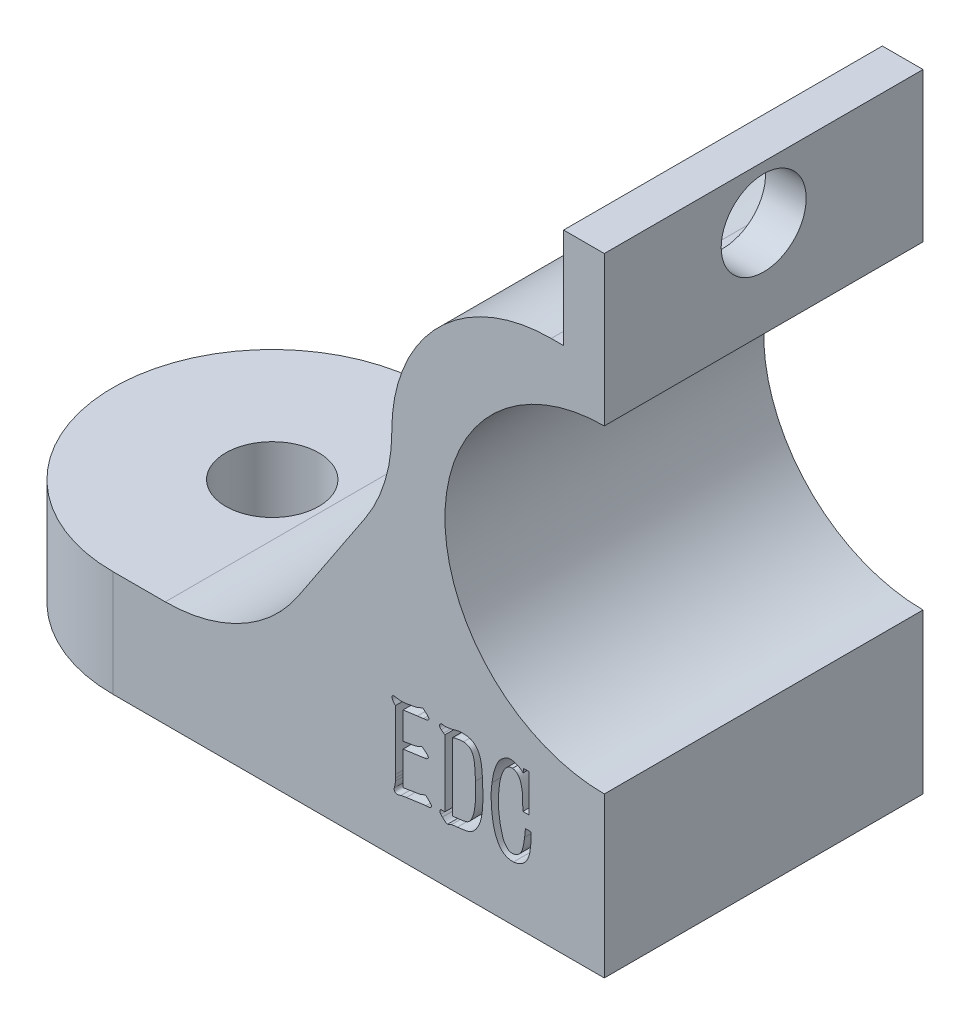
from build123d import *

# Parameters (mm, degrees)
SKETCH_1_R          = 1.75
EXTRUDE_1_DEPTH     = 4
EXTRUDE_2_DEPTH     = 12
SKETCH_3_R          = 1.6
CUT_EXTRUDE_1_DEPTH = 36.659822987
SKETCH_4_W          = 33.766554859
SKETCH_4_H          = 17.559956571
CUT_EXTRUDE_2_DEPTH = 35.359057397
FILLET_2_R          = 6
CUT_EXTRUDE_START   = -12
CUT_EXTRUDE_3_DEPTH = 12


# Read off the part's stored shape, not the designer's step: 切除-拉伸3
with BuildPart() as part:
    # 草图1 → 凸台-拉伸1 (new body)
    with BuildSketch(Plane(origin=(0, 0, 0), x_dir=(1, 0, 0), z_dir=(0, 1, 0))):
        with BuildLine():
            Line((-21.560120485, 6), (15.439879515, 6))
            ThreePointArc((15.439879515, 6), (21.439879515, 0), (15.439879515, -6))
            Line((15.439879515, -6), (-21.560120485, -6))
            ThreePointArc((-21.560120485, -6), (-27.560120485, 0), (-21.560120485, 6))
        make_face()
        with Locations(Location((-21.560120485, 0, 0), (0, 0, 270))):
            Circle(SKETCH_1_R, mode=Mode.SUBTRACT)
        with Locations(Location((15.439879515, 0, 0), (0, 0, 270))):
            Circle(SKETCH_1_R, mode=Mode.SUBTRACT)
    extrude(amount=EXTRUDE_1_DEPTH)

    # 草图2 → 凸台-拉伸2 (add, through all)
    with BuildSketch(Plane.XY.offset(6)):
        with BuildLine():
            Line((-11.060120485, 12), (-16.368422632, 4))
            Line((-16.368422632, 4), (-3.060120485, 4))
            Line((-3.060120485, 4), (-3.060120485, 6))
            ThreePointArc((-3.060120485, 6), (-9.060120485, 12), (-3.060120485, 18))
            Line((-3.060120485, 18), (-3.060120485, 23.621024031))
            Line((-3.060120485, 23.621024031), (-4.592219886, 23.621024031))
            Line((-4.592219886, 23.621024031), (-4.592219886, 19.851921512))
            Line((-4.592219886, 19.851921512), (-11.060120485, 19.851921512))
            Line((-11.060120485, 19.851921512), (-11.060120485, 12))
        make_face()
    extrude(amount=-EXTRUDE_2_DEPTH)

    # 草图3 → 切除-拉伸1 (cut, through all)
    with BuildSketch(Plane.ZY.offset(4.592219886)):
        with Locations((0, 21.621024031)):
            Circle(SKETCH_3_R)
    extrude(amount=-CUT_EXTRUDE_1_DEPTH, mode=Mode.SUBTRACT)

    # 草图4 → 切除-拉伸2 (cut, through all)
    with BuildSketch(Plane(origin=(0, 4, 0), x_dir=(1, 0, 0), z_dir=(0, 1, 0))):
        with Locations((13.823156945, -2.779978286)):
            Rectangle(SKETCH_4_W, SKETCH_4_H)
    extrude(amount=-CUT_EXTRUDE_2_DEPTH, mode=Mode.SUBTRACT)

    # 圆角2
    fillet_2_edges = [part.edges().sort_by_distance(p)[0] for p in [
        (-16.368422632, 4, 0),
        (-11.060120485, 12, 0),
        (-11.060120485, 19.851921512, 0),
    ]]
    fillet(fillet_2_edges, radius=FILLET_2_R)

    # 切除-拉伸3 outline → 切除-拉伸3 (cut)
    # profile 1 of 3: a face of its own
    with BuildSketch(Plane.XY.offset(6).offset(CUT_EXTRUDE_START)):
        with BuildLine():
            add(Edge.make_bspline(
                [(-6.543364146, 5.366767449), (-6.508335438, 5.361029912), (-6.438267686, 5.349553145), (-6.337194207, 5.314781698), (-6.242324982, 5.265146648), (-6.173248536, 5.210008143), (-6.133227112, 5.171818503), (-6.119581927, 5.157647179), (-6.117647589, 5.155617503)],
                knots=[0, 0, 0, 0, 0.181146539, 0.362346535, 0.543653396, 0.725617877, 0.811880467, 0.826217423, 0.826217423, 0.826217423, 0.826217423], degree=3))
            add(Edge.make_bspline(
                [(-7.289901542, 4.253300584), (-7.279879783, 4.328127804), (-7.259959472, 4.47686233), (-7.214534484, 4.657430919), (-7.170707329, 4.793132625), (-7.13789594, 4.884767369), (-7.101620716, 4.964571664), (-7.065437295, 5.035297703), (-7.024788163, 5.096764323), (-6.981937321, 5.151909633), (-6.935353145, 5.201055877), (-6.885627831, 5.242828497), (-6.836473889, 5.278356839), (-6.791315433, 5.308651764), (-6.750081717, 5.331283214), (-6.699732178, 5.35324973), (-6.630831866, 5.369486356), (-6.574035181, 5.367720849), (-6.543364146, 5.366767449)],
                knots=[0, 0, 0, 0, 0.154226345, 0.306556652, 0.379675384, 0.445752334, 0.50534458, 0.558760679, 0.607948867, 0.655725679, 0.701371485, 0.746071266, 0.78825069, 0.825317709, 0.857153149, 0.884242778, 0.937489417, 1, 1, 1, 1], degree=3))
            add(Edge.make_bspline(
                [(-6.47549711, 2.075589099), (-6.510638084, 2.0744179), (-6.581360904, 2.07206081), (-6.685505523, 2.09433433), (-6.782154953, 2.132259327), (-6.856567653, 2.174514822), (-6.908426717, 2.218265261), (-6.947052596, 2.255532905), (-6.983035534, 2.299823044), (-7.018549863, 2.349558105), (-7.052366262, 2.4052991), (-7.085614403, 2.466859111), (-7.116406, 2.534943981), (-7.1583976, 2.635153656), (-7.203041263, 2.773482172), (-7.238291564, 2.920747525), (-7.26172435, 3.047043321), (-7.276252896, 3.149144865), (-7.289790681, 3.256019226), (-7.30470151, 3.404818921), (-7.315481213, 3.591371373), (-7.32186884, 3.813515919), (-7.315337186, 4.033881744), (-7.298421574, 4.179803114), (-7.289901542, 4.253300584)],
                knots=[0, 0, 0, 0, 0.040560554, 0.081629972, 0.122067936, 0.160498857, 0.179908728, 0.200453509, 0.222515076, 0.245822335, 0.271131183, 0.297900222, 0.326730499, 0.357554046, 0.423594813, 0.494619703, 0.532646947, 0.572188961, 0.613933823, 0.657297468, 0.745202701, 0.830085187, 0.914417547, 1, 1, 1, 1], degree=3))
            add(Edge.make_bspline(
                [(-5.812488374, 3.380724407), (-5.812714105, 3.350146694), (-5.813123361, 3.29470863), (-5.813974432, 3.220379408), (-5.814373284, 3.163438332), (-5.815900718, 3.119915621), (-5.818656312, 3.081409673), (-5.821474042, 3.039364442), (-5.825959779, 2.98988409), (-5.834021703, 2.917381338), (-5.841837209, 2.831437177), (-5.85333973, 2.735231105), (-5.870127323, 2.640796436), (-5.901688637, 2.540477566), (-5.944932272, 2.432598259), (-5.994837567, 2.344473734), (-6.045525973, 2.278682702), (-6.090314465, 2.231755025), (-6.143965019, 2.190453225), (-6.202967252, 2.152772154), (-6.266513355, 2.120248581), (-6.334283403, 2.09769249), (-6.403921624, 2.081168558), (-6.451541161, 2.077456515), (-6.47549711, 2.075589099)],
                knots=[0, 0, 0, 0, 0.056090983, 0.101694181, 0.136353878, 0.160539566, 0.181560551, 0.207162126, 0.237837007, 0.272685179, 0.340973981, 0.396120934, 0.450409014, 0.516624624, 0.588604774, 0.663379156, 0.701414258, 0.7407581, 0.781993536, 0.825256768, 0.869102472, 0.91250966, 0.955986255, 1, 1, 1, 1], degree=3))
            Line((-5.812488374, 3.380724407), (-6.02951373, 3.391165489))
            Line((-6.02951373, 3.391165489), (-6.060091186, 3.086136723))
            add(Edge.make_bspline(
                [(-6.547838896, 2.333632994), (-6.525631806, 2.333500762), (-6.480676738, 2.333233079), (-6.41368105, 2.349280539), (-6.348627928, 2.376474627), (-6.287998154, 2.417915808), (-6.23274537, 2.472033589), (-6.186566119, 2.541580229), (-6.148204944, 2.624455891), (-6.121599707, 2.721287043), (-6.099857323, 2.827879189), (-6.08543861, 2.920245829), (-6.075067529, 2.990474555), (-6.067934851, 3.032384567), (-6.063698995, 3.063036369), (-6.061100311, 3.079675423), (-6.060091186, 3.086136723)],
                knots=[0, 0, 0, 0, 0.066450197, 0.134518894, 0.205066106, 0.277089639, 0.353600486, 0.435768077, 0.52624402, 0.62659438, 0.736355408, 0.852775754, 0.907126108, 0.949449962, 0.980370342, 1, 1, 1, 1], degree=3))
            add(Edge.make_bspline(
                [(-7.034840813, 3.485135231), (-7.031121319, 3.440612533), (-7.023461275, 3.348921081), (-7.009494057, 3.232282107), (-6.993789854, 3.132662507), (-6.978044182, 3.050108471), (-6.958562586, 2.960605656), (-6.936218581, 2.867851149), (-6.912964165, 2.778889167), (-6.889230729, 2.701543934), (-6.867252063, 2.638780885), (-6.838958222, 2.575783364), (-6.799397723, 2.511352804), (-6.74988934, 2.444872364), (-6.699315548, 2.392824506), (-6.650688847, 2.355592585), (-6.599607383, 2.337009706), (-6.565376207, 2.334776903), (-6.547838896, 2.333632994)],
                knots=[0, 0, 0, 0, 0.100728522, 0.2074435, 0.264759375, 0.328077893, 0.396897856, 0.471260082, 0.543180506, 0.604168904, 0.653635522, 0.693017991, 0.759632004, 0.823641362, 0.879525224, 0.922919229, 0.960509989, 1, 1, 1, 1], degree=3))
            add(Edge.make_bspline(
                [(-6.515769857, 5.109469346), (-6.531207113, 5.110064963), (-6.562368114, 5.111267251), (-6.60981353, 5.101923567), (-6.656384267, 5.081336378), (-6.703747357, 5.053200589), (-6.749889801, 5.013617243), (-6.792714078, 4.96180999), (-6.835074768, 4.899582634), (-6.872322903, 4.825615898), (-6.907053744, 4.744352388), (-6.93752408, 4.657611902), (-6.963789558, 4.566797209), (-6.990316619, 4.442675194), (-7.015010017, 4.291304331), (-7.033316669, 4.116916153), (-7.040375386, 3.952064041), (-7.04496665, 3.793667241), (-7.042408831, 3.638439526), (-7.037356032, 3.536085674), (-7.034840813, 3.485135231)],
                knots=[0, 0, 0, 0, 0.025029465, 0.050523433, 0.077664636, 0.10736617, 0.13972527, 0.175806298, 0.216226833, 0.261728794, 0.310019606, 0.359687961, 0.410926196, 0.463427513, 0.565701011, 0.659859465, 0.747978257, 0.833586678, 0.917161569, 1, 1, 1, 1], degree=3))
            add(Edge.make_bspline(
                [(-6.124229264, 3.899049572), (-6.124398406, 3.93484835), (-6.124708514, 4.000482867), (-6.126320967, 4.095698351), (-6.128800879, 4.189664943), (-6.131727104, 4.290849668), (-6.135061085, 4.39890092), (-6.144879545, 4.509239906), (-6.161382762, 4.620642606), (-6.185173265, 4.73203228), (-6.216348672, 4.838043913), (-6.253477113, 4.916757813), (-6.287210003, 4.970558271), (-6.313997185, 5.004726117), (-6.342430601, 5.03474392), (-6.384050182, 5.065720485), (-6.440863605, 5.096196362), (-6.490754969, 5.105036843), (-6.515769857, 5.109469346)],
                knots=[0, 0, 0, 0, 0.078227482, 0.143424532, 0.208089835, 0.283630523, 0.364637885, 0.444263732, 0.525545668, 0.610571659, 0.69304657, 0.766429327, 0.799885619, 0.831617141, 0.86119718, 0.889880721, 0.94478761, 1, 1, 1, 1], degree=3))
            Line((-6.124229264, 3.899049572), (-5.887067534, 3.899049572))
            Line((-5.887067534, 3.899049572), (-5.887067534, 5.313816245))
            Line((-5.887067534, 5.313816245), (-6.09887235, 5.313816245))
            Line((-6.09887235, 5.313816245), (-6.117647589, 5.155617503))
        make_face()
    # profile 2 of 3: a face of its own
    with BuildSketch(Plane.XY.offset(6).offset(CUT_EXTRUDE_START)):
        with BuildLine():
            add(Edge.make_bspline(
                [(-9.062648186, 4.927496194), (-9.070181792, 4.931599383), (-9.086380554, 4.940422061), (-9.101529485, 4.950950253), (-9.109633057, 4.956582067)],
                knots=[0, 0, 0, 0, 0.465072976, 1, 1, 1, 1], degree=3))
            Line((-9.062648186, 4.927496194), (-9.062648186, 2.417907445))
            Line((-9.062648186, 2.417907445), (-9.155126345, 2.417907445))
            add(Edge.make_bspline(
                [(-9.21329809, 2.262782791), (-9.220305342, 2.270781611), (-9.233062245, 2.285343692), (-9.246528071, 2.308100008), (-9.255563248, 2.328440674), (-9.254809399, 2.352793819), (-9.246066491, 2.377752745), (-9.229746288, 2.405103635), (-9.195857225, 2.420540119), (-9.170168984, 2.418879738), (-9.155126345, 2.417907445)],
                knots=[0, 0, 0, 0, 0.135453669, 0.246597291, 0.338065694, 0.414309589, 0.55095017, 0.674315892, 0.809284397, 1, 1, 1, 1], degree=3))
            Line((-9.21329809, 2.262782791), (-9.155872137, 2.200882088))
            add(Edge.make_bspline(
                [(-8.958237361, 2.066639599), (-8.966027112, 2.06637974), (-8.98342977, 2.065799202), (-9.010344636, 2.077514675), (-9.040530387, 2.09466526), (-9.071117301, 2.119470224), (-9.100173469, 2.14491751), (-9.124190808, 2.168156931), (-9.143251036, 2.18498614), (-9.152244402, 2.196313051), (-9.155872137, 2.200882088)],
                knots=[0, 0, 0, 0, 0.09428508, 0.210637185, 0.350900231, 0.519934663, 0.690086105, 0.823425343, 0.928773499, 1, 1, 1, 1], degree=3))
            add(Edge.make_bspline(
                [(-8.806095874, 2.130031886), (-8.818176847, 2.126943896), (-8.84689977, 2.119602095), (-8.887207012, 2.098077117), (-8.924299441, 2.076511065), (-8.948924382, 2.06934845), (-8.958237361, 2.066639599)],
                knots=[0, 0, 0, 0, 0.225502421, 0.536139678, 0.824571291, 1, 1, 1, 1], degree=3))
            Line((-8.806095874, 2.130031886), (-8.589070517, 2.154643009))
            add(Edge.make_bspline(
                [(-7.625507764, 3.559714392), (-7.626801335, 3.537592002), (-7.629533386, 3.490868987), (-7.632791719, 3.416732939), (-7.638462134, 3.334982842), (-7.645731143, 3.216689228), (-7.660237463, 3.066571856), (-7.686249917, 2.918894633), (-7.714055901, 2.804980767), (-7.739668574, 2.722922716), (-7.772623846, 2.644469354), (-7.808029535, 2.568862757), (-7.849310183, 2.49931305), (-7.892348964, 2.435342982), (-7.938556651, 2.378705455), (-7.987223181, 2.328660223), (-8.03958218, 2.286421933), (-8.096204337, 2.252668972), (-8.156511479, 2.226069119), (-8.222680852, 2.207510299), (-8.297235137, 2.193800312), (-8.382856521, 2.180627162), (-8.481562763, 2.167165832), (-8.551764982, 2.158988469), (-8.589070517, 2.154643009)],
                knots=[0, 0, 0, 0, 0.034032554, 0.071877565, 0.113958999, 0.159875043, 0.25389838, 0.345415653, 0.389862195, 0.433933293, 0.477252152, 0.520454768, 0.562034426, 0.601321324, 0.638767527, 0.674133794, 0.708358539, 0.741751196, 0.775089245, 0.809282033, 0.847019048, 0.891459031, 0.94232121, 1, 1, 1, 1], degree=3))
            add(Edge.make_bspline(
                [(-8.408588949, 5.317545203), (-8.384970324, 5.317231097), (-8.339179466, 5.316622119), (-8.272820335, 5.312745872), (-8.211154884, 5.303277794), (-8.153502778, 5.291627538), (-8.099295782, 5.276259769), (-8.048945751, 5.255295449), (-8.002427968, 5.228813436), (-7.945012825, 5.188030921), (-7.880475993, 5.128393712), (-7.828555841, 5.057131408), (-7.792871735, 4.994637942), (-7.768131019, 4.942381563), (-7.746964431, 4.884454528), (-7.726742868, 4.822091223), (-7.708829487, 4.754382575), (-7.693170358, 4.681747283), (-7.680943213, 4.603718181), (-7.665923273, 4.49402288), (-7.653333461, 4.354226424), (-7.646144664, 4.186217046), (-7.640407549, 4.017125911), (-7.635349189, 3.875903723), (-7.629767022, 3.765331134), (-7.627781411, 3.689735804), (-7.626154586, 3.622118332), (-7.62571391, 3.579602916), (-7.625507764, 3.559714392)],
                knots=[0, 0, 0, 0, 0.032322869, 0.062666305, 0.090856964, 0.11760919, 0.143121592, 0.167822844, 0.192041566, 0.216202886, 0.264098603, 0.311518435, 0.336200941, 0.362525872, 0.390514681, 0.42052837, 0.452213089, 0.486306076, 0.52215279, 0.560254347, 0.637801604, 0.714090463, 0.790336082, 0.869313804, 0.90745027, 0.941822123, 0.972784646, 1, 1, 1, 1], degree=3))
            add(Edge.make_bspline(
                [(-8.638292763, 5.286221956), (-8.621680064, 5.290387935), (-8.586947538, 5.299097838), (-8.531940167, 5.30881987), (-8.471823705, 5.314372833), (-8.430225391, 5.316459743), (-8.408588949, 5.317545203)],
                knots=[0, 0, 0, 0, 0.221093908, 0.462245781, 0.720299036, 1, 1, 1, 1], degree=3))
            Line((-8.638292763, 5.286221956), (-8.821757498, 5.234016544))
            Line((-8.821757498, 5.234016544), (-8.923185156, 5.223575461))
            add(Edge.make_bspline(
                [(-9.004476441, 5.209405421), (-9.002733784, 5.209639668), (-8.995964537, 5.210549587), (-8.980939555, 5.214069334), (-8.955506482, 5.218135259), (-8.935114082, 5.22156763), (-8.923185156, 5.223575461)],
                knots=[0, 0, 0, 0, 0.063902159, 0.248224169, 0.560234273, 1, 1, 1, 1], degree=3))
            Line((-9.004476441, 5.209405421), (-9.094717225, 5.209405421))
            Line((-9.094717225, 5.209405421), (-9.201365425, 5.224321253))
            add(Edge.make_bspline(
                [(-9.196890675, 5.029669644), (-9.208764954, 5.038684902), (-9.231207744, 5.055724044), (-9.252880205, 5.090694832), (-9.261582621, 5.126714139), (-9.257159402, 5.163235758), (-9.235184823, 5.19686018), (-9.213414926, 5.214537157), (-9.201365425, 5.224321253)],
                knots=[0, 0, 0, 0, 0.186824748, 0.353105091, 0.507602397, 0.64692401, 0.804574648, 1, 1, 1, 1], degree=3))
            Line((-9.196890675, 5.029669644), (-9.109633057, 4.956582067))
        make_face()
        with BuildLine():
            add(Edge.make_bspline(
                [(-8.78073896, 2.423127986), (-8.775265837, 2.423324051), (-8.758046283, 2.423940908), (-8.740945054, 2.426117773), (-8.729279339, 2.427602736)],
                knots=[0, 0, 0, 0, 0.317843486, 1, 1, 1, 1], degree=3))
            Line((-8.78073896, 2.423127986), (-8.78073896, 4.975226857))
            Line((-8.78073896, 4.975226857), (-8.747924129, 4.988651106))
            add(Edge.make_bspline(
                [(-8.361604078, 5.049806017), (-8.376275377, 5.050306095), (-8.407634571, 5.051374987), (-8.457904623, 5.047556295), (-8.514745055, 5.042033114), (-8.574832488, 5.031603105), (-8.632144915, 5.020047331), (-8.681089814, 5.010045489), (-8.718579263, 5.00007081), (-8.739269573, 4.99201907), (-8.747924129, 4.988651106)],
                knots=[0, 0, 0, 0, 0.111968851, 0.239328025, 0.384335123, 0.547796086, 0.704463791, 0.830630012, 0.929154181, 1, 1, 1, 1], degree=3))
            add(Edge.make_bspline(
                [(-7.906671199, 3.993765105), (-7.910255189, 4.051930972), (-7.917881948, 4.175708383), (-7.925776056, 4.332928835), (-7.934924443, 4.461766041), (-7.94433729, 4.551388367), (-7.956589355, 4.630670726), (-7.972768419, 4.700225928), (-7.990042965, 4.76217338), (-8.012160736, 4.81672234), (-8.035736067, 4.865698221), (-8.062644768, 4.90875072), (-8.093161754, 4.94579609), (-8.128101963, 4.975986391), (-8.166674377, 5.000579574), (-8.221447027, 5.022254824), (-8.286359246, 5.041440254), (-8.338121859, 5.047195251), (-8.361604078, 5.049806017)],
                knots=[0, 0, 0, 0, 0.136640976, 0.290773049, 0.369097972, 0.439454447, 0.502030717, 0.557036223, 0.606838664, 0.652624568, 0.694855191, 0.734151897, 0.771393271, 0.806925877, 0.842020712, 0.878070684, 0.94468651, 1, 1, 1, 1], degree=3))
            add(Edge.make_bspline(
                [(-8.51150819, 2.452213859), (-8.483884364, 2.454913839), (-8.431692178, 2.460015155), (-8.357806633, 2.47160031), (-8.293246019, 2.487643439), (-8.235253207, 2.504575257), (-8.183481844, 2.530872757), (-8.137686378, 2.568718649), (-8.097936185, 2.618865639), (-8.05167195, 2.69806357), (-8.005810602, 2.804061637), (-7.966643745, 2.936376528), (-7.941245386, 3.074552993), (-7.922081963, 3.224705561), (-7.908569962, 3.390431116), (-7.904343115, 3.539298332), (-7.903575005, 3.667355443), (-7.903618703, 3.771271146), (-7.904121743, 3.880664379), (-7.90580826, 3.9554828), (-7.906671199, 3.993765105)],
                knots=[0, 0, 0, 0, 0.044586728, 0.084241725, 0.119983467, 0.151431271, 0.181080545, 0.212579023, 0.246072531, 0.283330476, 0.359683619, 0.430945885, 0.504568203, 0.585111347, 0.674059169, 0.771554225, 0.824270638, 0.879781026, 0.938487614, 1, 1, 1, 1], degree=3))
            Line((-8.51150819, 2.452213859), (-8.729279339, 2.427602736))
        make_face(mode=Mode.SUBTRACT)
    # profile 3 of 3: a face of its own
    with BuildSketch(Plane.XY.offset(6).offset(CUT_EXTRUDE_START)):
        with BuildLine():
            add(Edge.make_bspline(
                [(-10.324527581, 3.983324023), (-10.310348478, 3.98550195), (-10.278675429, 3.990366967), (-10.229570174, 3.999327657), (-10.180692863, 4.010798559), (-10.136927918, 4.021719165), (-10.100229, 4.034191126), (-10.067601987, 4.046749387), (-10.038403485, 4.061112976), (-10.021582344, 4.073569833), (-10.013532482, 4.07953114)],
                knots=[0, 0, 0, 0, 0.130990317, 0.292604035, 0.455598752, 0.589391318, 0.704242921, 0.809202221, 0.908692525, 1, 1, 1, 1], degree=3))
            Line((-10.324527581, 3.983324023), (-10.637760055, 3.930372819))
            Line((-10.637760055, 3.930372819), (-10.637760055, 4.950912714))
            Line((-10.637760055, 4.950912714), (-10.095569558, 5.025194895))
            add(Edge.make_bspline(
                [(-9.867357327, 5.055026559), (-9.884761002, 5.052803456), (-9.917335725, 5.048642441), (-9.962821541, 5.042619105), (-10.001385705, 5.037629612), (-10.033113178, 5.032701769), (-10.058285114, 5.029958933), (-10.076688464, 5.027779584), (-10.088366288, 5.02623285), (-10.093829677, 5.025445603), (-10.095569558, 5.025194895)],
                knots=[0, 0, 0, 0, 0.228689354, 0.428041364, 0.59805775, 0.735532814, 0.846463445, 0.928052575, 0.977087489, 1, 1, 1, 1], degree=3))
            Line((-9.867357327, 5.055026559), (-9.79426975, 5.06472185))
            add(Edge.make_bspline(
                [(-9.7010458, 5.220592295), (-9.694591554, 5.212046359), (-9.683093032, 5.196821398), (-9.670913701, 5.174760161), (-9.661420329, 5.158571508), (-9.657381711, 5.140103482), (-9.670293506, 5.116481645), (-9.69697993, 5.091486528), (-9.74003531, 5.067447583), (-9.775248816, 5.06567781), (-9.79426975, 5.06472185)],
                knots=[0, 0, 0, 0, 0.125664459, 0.223876746, 0.295739572, 0.346174886, 0.437869688, 0.590747101, 0.778937871, 1, 1, 1, 1], degree=3))
            Line((-9.7010458, 5.220592295), (-9.890476867, 5.387649614))
            Line((-9.890476867, 5.387649614), (-9.990412942, 5.348122659))
            add(Edge.make_bspline(
                [(-10.301408041, 5.257881875), (-10.28250647, 5.260809265), (-10.249630238, 5.265900988), (-10.203747765, 5.273731235), (-10.162132829, 5.283314176), (-10.120007748, 5.29583926), (-10.078354914, 5.308967564), (-10.041848984, 5.322494787), (-10.012626626, 5.334184523), (-9.99703289, 5.343968925), (-9.990412942, 5.348122659)],
                knots=[0, 0, 0, 0, 0.176185082, 0.306445521, 0.42864751, 0.569245449, 0.711179619, 0.830713641, 0.928133516, 1, 1, 1, 1], degree=3))
            Line((-10.301408041, 5.257881875), (-10.506500732, 5.220592295))
            add(Edge.make_bspline(
                [(-10.678778593, 5.209405421), (-10.66062874, 5.209294726), (-10.626807424, 5.209088452), (-10.579783028, 5.210405872), (-10.540281865, 5.213481005), (-10.516910552, 5.218400917), (-10.506500732, 5.220592295)],
                knots=[0, 0, 0, 0, 0.314625091, 0.586287644, 0.815728322, 1, 1, 1, 1], degree=3))
            Line((-10.678778593, 5.209405421), (-10.699660758, 5.208659629))
            add(Edge.make_bspline(
                [(-10.847327496, 5.219100712), (-10.828425522, 5.216438242), (-10.796120489, 5.211887862), (-10.754067817, 5.205126274), (-10.723363202, 5.204662239), (-10.706603043, 5.207488821), (-10.699660758, 5.208659629)],
                knots=[0, 0, 0, 0, 0.384867899, 0.657771003, 0.858244108, 1, 1, 1, 1], degree=3))
            Line((-10.847327496, 5.219100712), (-10.942788821, 5.234016544))
            add(Edge.make_bspline(
                [(-10.924144031, 4.950615734), (-10.93133807, 4.959081201), (-10.947664339, 4.978292869), (-10.973740939, 5.008220497), (-10.999855712, 5.039667397), (-11.022341185, 5.069631837), (-11.038775477, 5.099028056), (-11.046490726, 5.130975698), (-11.045478905, 5.164909598), (-11.045691781, 5.19490122), (-11.033874555, 5.2194417), (-11.011191185, 5.230116024), (-10.980417848, 5.235561291), (-10.95651365, 5.234579976), (-10.942788821, 5.234016544)],
                knots=[0, 0, 0, 0, 0.082853737, 0.1880296, 0.296043335, 0.387645757, 0.467262338, 0.545507056, 0.628960216, 0.720280755, 0.766743288, 0.822395889, 0.898026869, 1, 1, 1, 1], degree=3))
            Line((-10.924144031, 4.950615734), (-10.91892349, 2.705783004))
            add(Edge.make_bspline(
                [(-10.924144031, 2.583473181), (-10.923320714, 2.597142624), (-10.921809177, 2.622238507), (-10.920822126, 2.65632884), (-10.918620979, 2.68338668), (-10.918832792, 2.699068249), (-10.91892349, 2.705783004)],
                knots=[0, 0, 0, 0, 0.33549466, 0.615938402, 0.835547081, 1, 1, 1, 1], degree=3))
            Line((-10.924144031, 2.583473181), (-10.924144031, 2.489503439))
            add(Edge.make_bspline(
                [(-10.968891527, 2.240409043), (-10.968103457, 2.247168054), (-10.966045976, 2.264814383), (-10.955171805, 2.293726341), (-10.944296156, 2.329452658), (-10.935669217, 2.37215146), (-10.928964001, 2.425720535), (-10.925911476, 2.466114759), (-10.924144031, 2.489503439)],
                knots=[0, 0, 0, 0, 0.080154866, 0.209267186, 0.362564664, 0.521523827, 0.722957268, 1, 1, 1, 1], degree=3))
            add(Edge.make_bspline(
                [(-10.713830798, 2.124811345), (-10.734543458, 2.117369393), (-10.775488995, 2.102657872), (-10.828478186, 2.091463655), (-10.869396701, 2.091043032), (-10.897528329, 2.095808856), (-10.921641752, 2.108309534), (-10.9426004, 2.125765753), (-10.957966291, 2.148931658), (-10.967826832, 2.176254725), (-10.972601824, 2.207266993), (-10.970171431, 2.228976367), (-10.968891527, 2.240409043)],
                knots=[0, 0, 0, 0, 0.182087604, 0.359957387, 0.444272652, 0.519692124, 0.593266627, 0.666206108, 0.743207106, 0.819988101, 0.905201423, 1, 1, 1, 1], degree=3))
            Line((-10.713830798, 2.124811345), (-10.510975482, 2.15986355))
            add(Edge.make_bspline(
                [(-9.773387585, 2.263528583), (-9.792780366, 2.261561449), (-9.834815476, 2.257297557), (-9.902968, 2.249884338), (-9.980787214, 2.240192271), (-10.068281001, 2.22813396), (-10.165241483, 2.213989294), (-10.271810217, 2.197305932), (-10.388236898, 2.179691039), (-10.468973961, 2.166648578), (-10.510975482, 2.15986355)],
                knots=[0, 0, 0, 0, 0.078496334, 0.17014589, 0.276065189, 0.394285394, 0.525812547, 0.670655771, 0.828666561, 1, 1, 1, 1], degree=3))
            Line((-9.773387585, 2.263528583), (-9.703283174, 2.268003333))
            add(Edge.make_bspline(
                [(-9.604838683, 2.425365361), (-9.59750217, 2.416656421), (-9.584336707, 2.401028119), (-9.571552073, 2.376957508), (-9.564342863, 2.355736518), (-9.569466298, 2.33249332), (-9.582410947, 2.310169259), (-9.59749418, 2.288833005), (-9.617406222, 2.277720688), (-9.639558014, 2.272127441), (-9.668880176, 2.268868039), (-9.691092154, 2.268309749), (-9.703283174, 2.268003333)],
                knots=[0, 0, 0, 0, 0.128778164, 0.231094015, 0.309853046, 0.375771773, 0.493216524, 0.603483504, 0.665475281, 0.747701152, 0.861526043, 1, 1, 1, 1], degree=3))
            Line((-9.604838683, 2.425365361), (-9.781591293, 2.596151639))
            Line((-9.781591293, 2.596151639), (-9.882273159, 2.564828391))
            add(Edge.make_bspline(
                [(-10.004582983, 2.520826687), (-9.994602383, 2.522647689), (-9.974169495, 2.526375754), (-9.943583956, 2.535315969), (-9.912646594, 2.548204686), (-9.892617886, 2.559166612), (-9.882273159, 2.564828391)],
                knots=[0, 0, 0, 0, 0.232685934, 0.476368751, 0.729547112, 1, 1, 1, 1], degree=3))
            Line((-10.004582983, 2.520826687), (-10.637760055, 2.417907445))
            Line((-10.637760055, 2.417907445), (-10.637760055, 3.673820507))
            Line((-10.637760055, 3.673820507), (-9.812168749, 3.790163997))
            add(Edge.make_bspline(
                [(-9.729385881, 3.953492359), (-9.721962881, 3.944703317), (-9.708616003, 3.928900233), (-9.693636817, 3.905836624), (-9.684319508, 3.887212129), (-9.681436153, 3.866171587), (-9.695850594, 3.841611869), (-9.722247058, 3.815791267), (-9.763051618, 3.793824104), (-9.795219701, 3.791427005), (-9.812168749, 3.790163997)],
                knots=[0, 0, 0, 0, 0.133343141, 0.239756827, 0.318540792, 0.373648818, 0.478208945, 0.629142271, 0.804598699, 1, 1, 1, 1], degree=3))
            Line((-9.729385881, 3.953492359), (-9.912850615, 4.113091762))
            Line((-9.912850615, 4.113091762), (-10.013532482, 4.07953114))
        make_face()
    extrude(amount=CUT_EXTRUDE_3_DEPTH, mode=Mode.SUBTRACT)


solid = part.part
